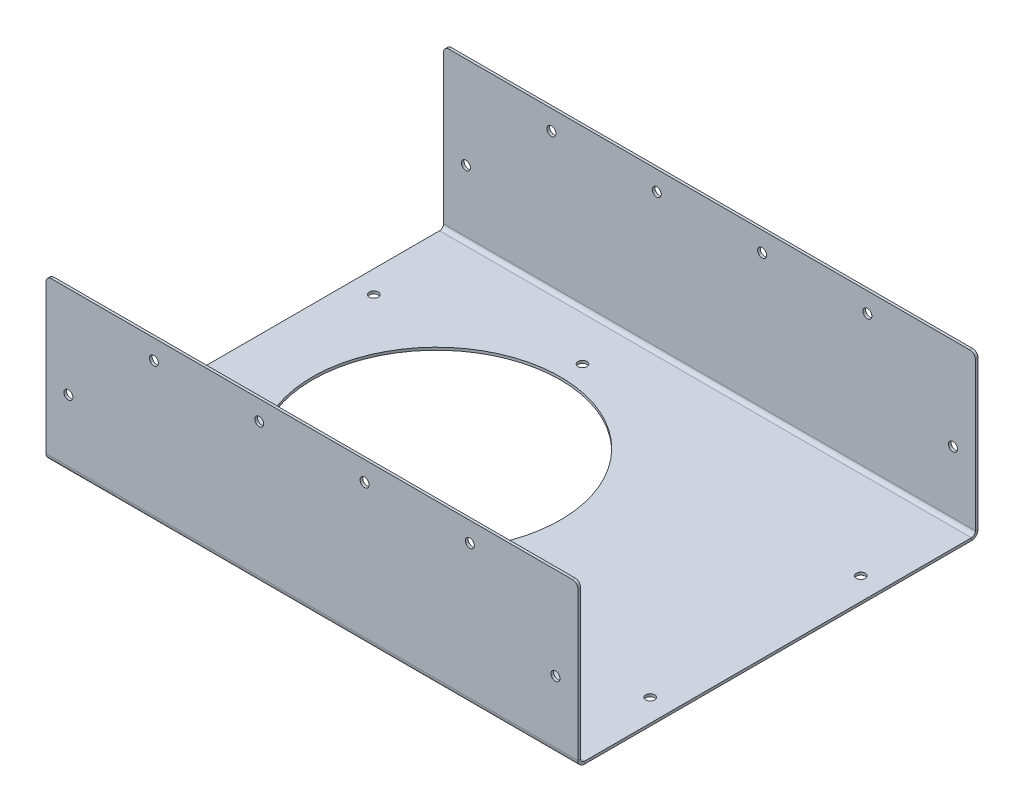
from build123d import *

# Parameters (mm, degrees)
CROQUIS1_W                      = 200
CROQUIS1_H                      = 150
SALIENTE_EXTRUIR1_DEPTH         = 60
VACIADO1_T                      = 1
CROQUIS3_R                      = 1.7
CORTAR_EXTRUIR2_DEPTH           = 60
CORTAR_EXTRUIR3_DEPTH           = 190
CORTAR_EXTRUIR3_DEPTH_BACK      = 104
CROQUIS4_R                      = 1.7
CORTAR_EXTRUIR4_DEPTH           = 1
TALADRO_DE_MARGEN_PARA_M31_D    = 3.4
CROQUIS14_W                     = 150
CROQUIS14_H                     = 60
CORTAR_EXTRUIR5_DEPTH           = 210
DESPLEGAR_PLIEGUES2_OUTLINE_W   = 202
DESPLEGAR_PLIEGUES2_OUTLINE_H   = 1
DESPLEGAR_PLIEGUES2_DEPTH       = 60
DESPLEGAR_START                 = -1
DESPLEGAR_PLIEGUES2_2_OUTLINE_W = 202
DESPLEGAR_PLIEGUES2_2_OUTLINE_H = 59.141592654
DESPLEGAR_PLIEGUES2_2_OUTLINE_R = 1.7
DESPLEGAR_PLIEGUES2_2_DEPTH     = 1
PROCESAR_START                  = -210.141592654
PROCESAR_PLIEGUES2_OUTLINE_W    = 202
PROCESAR_PLIEGUES2_OUTLINE_H    = 1
PROCESAR_PLIEGUES2_DEPTH        = 59.398442654
PROCESAR_START_2                = 0.74315
PROCESAR_PLIEGUES2_2_OUTLINE_W  = 202
PROCESAR_PLIEGUES2_2_OUTLINE_H  = 1
PROCESAR_PLIEGUES2_2_DEPTH      = 59.398442654
PROCESAR_START_3                = -151
PROCESAR_PLIEGUES2_3_OUTLINE_W  = 202
PROCESAR_PLIEGUES2_3_OUTLINE_H  = 60
PROCESAR_PLIEGUES2_3_OUTLINE_R  = 1.7
PROCESAR_PLIEGUES2_3_DEPTH      = 2.5
PROCESAR_START_4                = -1.5
PROCESAR_PLIEGUES2_4_OUTLINE_W  = 202
PROCESAR_PLIEGUES2_4_OUTLINE_H  = 60
PROCESAR_PLIEGUES2_4_OUTLINE_R  = 1.7
PROCESAR_PLIEGUES2_4_DEPTH      = 2.5
PROCESAR_START_5                = -1
PROCESAR_PLIEGUES2_5_DEPTH      = 202
REDONDEO1_R                     = 2


with BuildPart() as part:
    # Croquis1 → Saliente-Extruir1 (new body)
    with BuildSketch(Plane(origin=(0, 0, 0), x_dir=(1, 0, 0), z_dir=(0, 1, 0))):
        with Locations((100, 75)):
            Rectangle(CROQUIS1_W, CROQUIS1_H)
    extrude(amount=SALIENTE_EXTRUIR1_DEPTH)

    # Vaciado1
    vaciado1_openings = [part.faces().sort_by_distance(p)[0] for p in [
        (100, 60, -75),
    ]]
    offset(amount=VACIADO1_T, openings=vaciado1_openings, kind=Kind.INTERSECTION)

    # Croquis3 → Cortar-Extruir2 (cut)
    with BuildSketch(Plane(origin=(0, 0, 0), x_dir=(-1, 0, 0), z_dir=(0, 1, 0))):
        with Locations(Location((-192.5, -35, 0), (0, 0, 90))):
            Circle(CROQUIS3_R)
        with Locations(Location((-192.5, -115, 0), (0, 0, 90))):
            Circle(CROQUIS3_R)
        with Locations(Location((-7.5, -35, 0), (0, 0, 90))):
            Circle(CROQUIS3_R)
        with Locations(Location((-7.5, -115, 0), (0, 0, 90))):
            Circle(CROQUIS3_R)
    extrude(amount=-CORTAR_EXTRUIR2_DEPTH, mode=Mode.SUBTRACT)

    # Croquis4 → Cortar-Extruir3 (cut, two sides: drawn at the far end of the back side and taken through both)
    with BuildSketch(Plane.XY.offset(-150).offset(-CORTAR_EXTRUIR3_DEPTH_BACK)):
        with Locations((192.5, 25)):
            Circle(CROQUIS4_R)
        with Locations((160, 52.5)):
            Circle(CROQUIS4_R)
        with Locations((120, 52.5)):
            Circle(CROQUIS4_R)
        with Locations((80, 52.5)):
            Circle(CROQUIS4_R)
        with Locations((40, 52.5)):
            Circle(CROQUIS4_R)
        with Locations((7.5, 25)):
            Circle(CROQUIS4_R)
    extrude(amount=CORTAR_EXTRUIR3_DEPTH + CORTAR_EXTRUIR3_DEPTH_BACK, mode=Mode.SUBTRACT)

    # Croquis5 → Cortar-Extruir4 (cut)
    with BuildSketch(Plane(origin=(0, 0, 0), x_dir=(1, 0, 0), z_dir=(0, 1, 0))):
        with BuildLine():
            ThreePointArc((117.1, 76.283509089), (103.304729394, 109.588238483), (70, 123.383509089))
            Line((70, 123.383509089), (70, 29.183509089))
            ThreePointArc((70, 29.183509089), (103.304729394, 42.978779695), (117.1, 76.283509089))
        make_face()
        with BuildLine():
            Line((70, 29.183509089), (70, 123.383509089))
            ThreePointArc((70, 123.383509089), (22.9, 76.283509089), (70, 29.183509089))
        make_face()
    extrude(amount=-CORTAR_EXTRUIR4_DEPTH, mode=Mode.SUBTRACT)

    # Taladro de margen para M31 (through all)
    with Locations(Plane(origin=(0, 0, 0), x_dir=(1, 0, 0), z_dir=(0, 1, 0))):
        with Locations((70, 20.783509089), (70, 131.783509089)):
            Hole(TALADRO_DE_MARGEN_PARA_M31_D / 2)

    # Croquis14 → Cortar-Extruir5 (cut)
    with BuildSketch(Plane(origin=(201, 0, 0), x_dir=(0, 0, -1), z_dir=(1, 0, 0))):
        with Locations((75, 30)):
            Rectangle(CROQUIS14_W, CROQUIS14_H)
    extrude(amount=-CORTAR_EXTRUIR5_DEPTH, mode=Mode.SUBTRACT)

    # Desplegar pliegues2: read off the stored shape, not the designer's step
    # Desplegar pliegues2 outline → Desplegar pliegues2 (cut)
    with BuildSketch(Plane(origin=(0, 0, 0), x_dir=(1, 0, 0), z_dir=(0, 1, 0))):
        with Locations((100, 150.5)):
            Rectangle(DESPLEGAR_PLIEGUES2_OUTLINE_W, DESPLEGAR_PLIEGUES2_OUTLINE_H)
        with Locations((100, -0.5)):
            Rectangle(DESPLEGAR_PLIEGUES2_OUTLINE_W, DESPLEGAR_PLIEGUES2_OUTLINE_H)
    extrude(amount=DESPLEGAR_PLIEGUES2_DEPTH, mode=Mode.SUBTRACT)

    # Desplegar pliegues2 2 outline → Desplegar pliegues2 2 (add)
    # profile 1 of 2: a face of its own
    with BuildSketch(Plane(origin=(0, 0, 0), x_dir=(1, 0, 0), z_dir=(0, 1, 0)).offset(DESPLEGAR_START)):
        with Locations((100, 180.570796327)):
            Rectangle(DESPLEGAR_PLIEGUES2_2_OUTLINE_W, DESPLEGAR_PLIEGUES2_2_OUTLINE_H)
        with Locations((7.5, 175.141592654)):
            Circle(DESPLEGAR_PLIEGUES2_2_OUTLINE_R, mode=Mode.SUBTRACT)
        with Locations((40, 202.641592654)):
            Circle(DESPLEGAR_PLIEGUES2_2_OUTLINE_R, mode=Mode.SUBTRACT)
        with Locations((80, 202.641592654)):
            Circle(DESPLEGAR_PLIEGUES2_2_OUTLINE_R, mode=Mode.SUBTRACT)
        with Locations((120, 202.641592654)):
            Circle(DESPLEGAR_PLIEGUES2_2_OUTLINE_R, mode=Mode.SUBTRACT)
        with Locations((192.5, 175.141592654)):
            Circle(DESPLEGAR_PLIEGUES2_2_OUTLINE_R, mode=Mode.SUBTRACT)
        with Locations((160, 202.641592654)):
            Circle(DESPLEGAR_PLIEGUES2_2_OUTLINE_R, mode=Mode.SUBTRACT)
    # profile 2 of 2: a face of its own
    with BuildSketch(Plane(origin=(0, 0, 0), x_dir=(1, 0, 0), z_dir=(0, 1, 0)).offset(DESPLEGAR_START)):
        with Locations((100, -30.570796327)):
            Rectangle(DESPLEGAR_PLIEGUES2_2_OUTLINE_W, DESPLEGAR_PLIEGUES2_2_OUTLINE_H)
        with Locations((40, -52.641592654)):
            Circle(DESPLEGAR_PLIEGUES2_2_OUTLINE_R, mode=Mode.SUBTRACT)
        with Locations((7.5, -25.141592654)):
            Circle(DESPLEGAR_PLIEGUES2_2_OUTLINE_R, mode=Mode.SUBTRACT)
        with Locations((80, -52.641592654)):
            Circle(DESPLEGAR_PLIEGUES2_2_OUTLINE_R, mode=Mode.SUBTRACT)
        with Locations((120, -52.641592654)):
            Circle(DESPLEGAR_PLIEGUES2_2_OUTLINE_R, mode=Mode.SUBTRACT)
        with Locations((160, -52.641592654)):
            Circle(DESPLEGAR_PLIEGUES2_2_OUTLINE_R, mode=Mode.SUBTRACT)
        with Locations((192.5, -25.141592654)):
            Circle(DESPLEGAR_PLIEGUES2_2_OUTLINE_R, mode=Mode.SUBTRACT)
    extrude(amount=DESPLEGAR_PLIEGUES2_2_DEPTH)

    # Procesar pliegues2: read off the stored shape, not the designer's step
    # Procesar pliegues2 outline → Procesar pliegues2 (cut)
    with BuildSketch(Plane.XY.offset(PROCESAR_START)):
        with Locations((100, -0.5)):
            Rectangle(PROCESAR_PLIEGUES2_OUTLINE_W, PROCESAR_PLIEGUES2_OUTLINE_H)
    extrude(amount=PROCESAR_PLIEGUES2_DEPTH, mode=Mode.SUBTRACT)

    # Procesar pliegues2 2 outline → Procesar pliegues2 2 (cut)
    with BuildSketch(Plane.XY.offset(PROCESAR_START_2)):
        with Locations((100, -0.5)):
            Rectangle(PROCESAR_PLIEGUES2_2_OUTLINE_W, PROCESAR_PLIEGUES2_2_OUTLINE_H)
    extrude(amount=PROCESAR_PLIEGUES2_2_DEPTH, mode=Mode.SUBTRACT)

    # Procesar pliegues2 3 outline → Procesar pliegues2 3 (add)
    with BuildSketch(Plane.XY.offset(PROCESAR_START_3)):
        with Locations((100, 30)):
            Rectangle(PROCESAR_PLIEGUES2_3_OUTLINE_W, PROCESAR_PLIEGUES2_3_OUTLINE_H)
        with Locations((7.5, 25)):
            Circle(PROCESAR_PLIEGUES2_3_OUTLINE_R, mode=Mode.SUBTRACT)
        with Locations((192.5, 25)):
            Circle(PROCESAR_PLIEGUES2_3_OUTLINE_R, mode=Mode.SUBTRACT)
        with Locations((40, 52.5)):
            Circle(PROCESAR_PLIEGUES2_3_OUTLINE_R, mode=Mode.SUBTRACT)
        with Locations((80, 52.5)):
            Circle(PROCESAR_PLIEGUES2_3_OUTLINE_R, mode=Mode.SUBTRACT)
        with Locations((120, 52.5)):
            Circle(PROCESAR_PLIEGUES2_3_OUTLINE_R, mode=Mode.SUBTRACT)
        with Locations((160, 52.5)):
            Circle(PROCESAR_PLIEGUES2_3_OUTLINE_R, mode=Mode.SUBTRACT)
    extrude(amount=PROCESAR_PLIEGUES2_3_DEPTH)

    # Procesar pliegues2 4 outline → Procesar pliegues2 4 (add)
    with BuildSketch(Plane.XY.offset(PROCESAR_START_4)):
        with Locations((100, 30)):
            Rectangle(PROCESAR_PLIEGUES2_4_OUTLINE_W, PROCESAR_PLIEGUES2_4_OUTLINE_H)
        with Locations((7.5, 25)):
            Circle(PROCESAR_PLIEGUES2_4_OUTLINE_R, mode=Mode.SUBTRACT)
        with Locations((192.5, 25)):
            Circle(PROCESAR_PLIEGUES2_4_OUTLINE_R, mode=Mode.SUBTRACT)
        with Locations((40, 52.5)):
            Circle(PROCESAR_PLIEGUES2_4_OUTLINE_R, mode=Mode.SUBTRACT)
        with Locations((80, 52.5)):
            Circle(PROCESAR_PLIEGUES2_4_OUTLINE_R, mode=Mode.SUBTRACT)
        with Locations((120, 52.5)):
            Circle(PROCESAR_PLIEGUES2_4_OUTLINE_R, mode=Mode.SUBTRACT)
        with Locations((160, 52.5)):
            Circle(PROCESAR_PLIEGUES2_4_OUTLINE_R, mode=Mode.SUBTRACT)
    extrude(amount=PROCESAR_PLIEGUES2_4_DEPTH)

    # Procesar pliegues2 5 outline → Procesar pliegues2 5 (cut)
    with BuildSketch(Plane.YZ.offset(PROCESAR_START_5)):
        with BuildLine():
            Line((1.5, -150), (60, -150))
            Line((60, -150), (60, -148.5))
            Line((60, -148.5), (0, -148.5))
            ThreePointArc((0, -148.5), (0.439339828, -149.560660172), (1.5, -150))
        make_face()
        with BuildLine():
            ThreePointArc((1.5, -151), (-0.267766953, -150.267766953), (-1, -148.5))
            Line((-1, -148.5), (-1, -150.74315))
            Line((-1, -150.74315), (0, -150.74315))
            Line((0, -150.74315), (0, -151))
            Line((0, -151), (1.5, -151))
        make_face()
        with BuildLine():
            ThreePointArc((-1, -1.5), (-0.267766953, 0.267766953), (1.5, 1))
            Line((1.5, 1), (0, 1))
            Line((0, 1), (0, 0.74315))
            Line((0, 0.74315), (-1, 0.74315))
            Line((-1, 0.74315), (-1, -1.5))
        make_face()
        with BuildLine():
            Line((60, 0), (1.5, 0))
            ThreePointArc((1.5, 0), (0.439339828, -0.439339828), (0, -1.5))
            Line((0, -1.5), (60, -1.5))
            Line((60, -1.5), (60, 0))
        make_face()
    extrude(amount=PROCESAR_PLIEGUES2_5_DEPTH, mode=Mode.SUBTRACT)

    # Redondeo1
    redondeo1_edges = [part.edges().sort_by_distance(p)[0] for p in [
        (201, 60, -150.5),
        (-1, 60, -150.5),
        (-1, 60, 0.5),
        (201, 60, 0.5),
    ]]
    fillet(redondeo1_edges, radius=REDONDEO1_R)


solid = part.part
